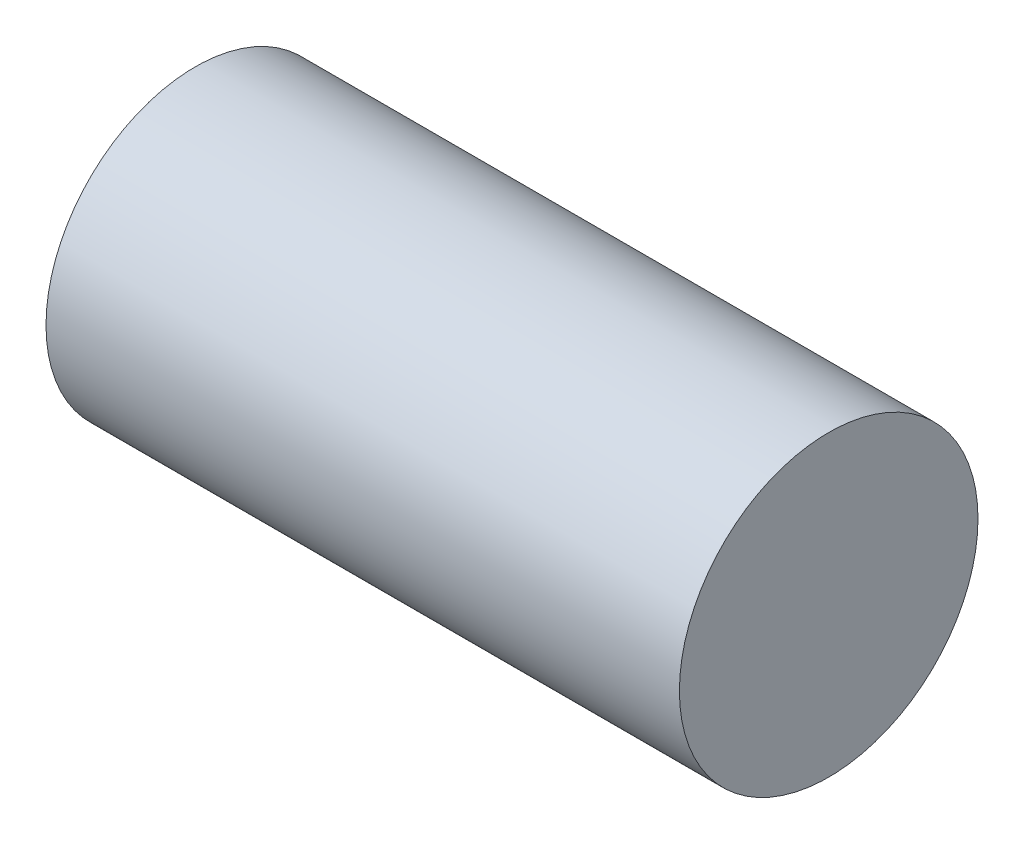
from build123d import *

# Parameters (mm, degrees)
BOSS_EXTRUDE1_DEPTH      = 35
BOSS_EXTRUDE1_DEPTH_BACK = 35
SKETCH1_R                = 16.5


with BuildPart() as part:
    # Sketch1 → Boss-Extrude1 (new, two sides: drawn at the far end of the back side and taken through both)
    with BuildSketch(Plane(origin=(0, 0, 0), x_dir=(0, 0, -1), z_dir=(1, 0, 0)).offset(-BOSS_EXTRUDE1_DEPTH_BACK)):
        Circle(SKETCH1_R)
    extrude(amount=BOSS_EXTRUDE1_DEPTH + BOSS_EXTRUDE1_DEPTH_BACK)


solid = part.part
